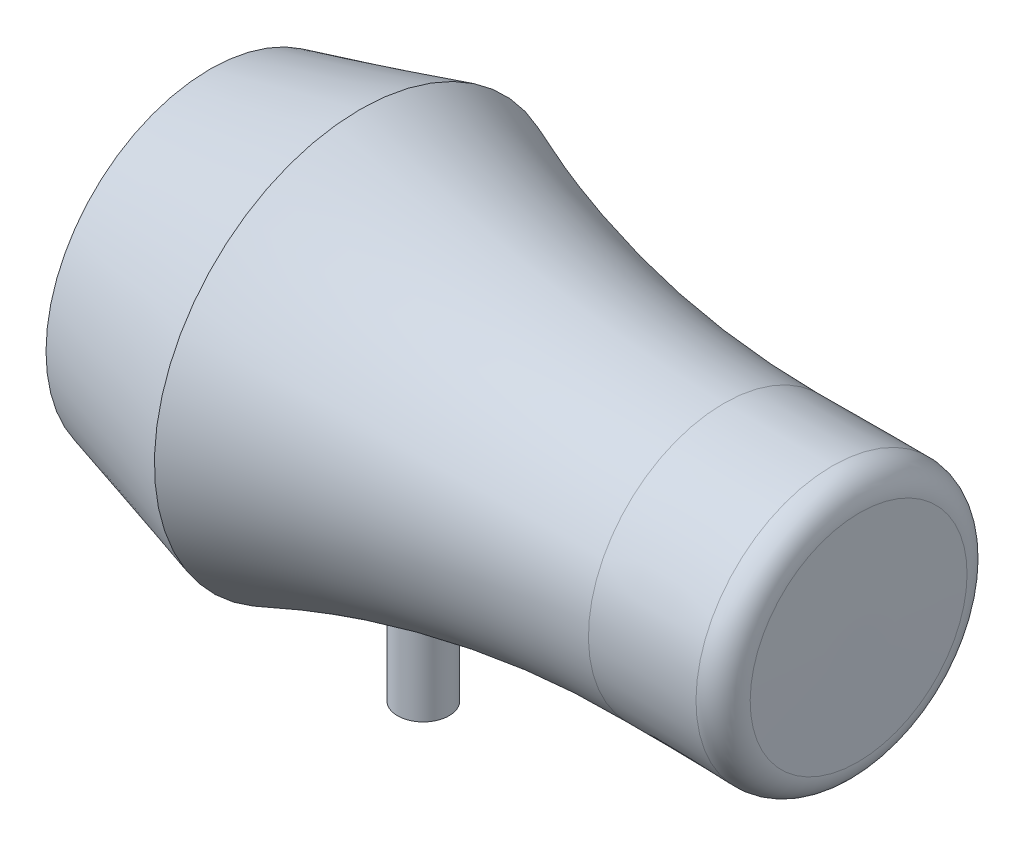
from build123d import *

# Parameters (mm, degrees)
FILLET2_R           = 5.08
SKETCH3_R           = 4.826
BOSS_EXTRUDE1_DEPTH = 12.7
SKETCH5_R           = 4.826
BOSS_EXTRUDE2_DEPTH = 12.7


with BuildPart() as part:
    # Sketch1 → Revolve2 (revolve)
    with BuildSketch(Plane.XY):
        with BuildLine():
            Line((45.524615385, -0.976923077), (45.524615385, 24.423076923))
            Line((45.524615385, 24.423076923), (20.124615385, 24.423076923))
            ThreePointArc((20.124615385, 24.423076923), (-14.744833443, 27.875832785), (-48.26, 38.1))
            Line((-48.26, 38.1), (-50.8, 38.1))
            Line((-50.8, 38.1), (-76.2, 38.1))
            Line((-76.2, 38.1), (-76.2, 0))
            Line((-76.2, 0), (45.524615385, -0.976923077))
        make_face()
    revolve(axis=Axis((45.524615385, -0.976923077, 0), (-0.9999677957684845, 0.008025423722058495, 0)))

    # Fillet2
    fillet2_edges = [part.edges().sort_by_distance(p)[0] for p in [
        (45.116936989, -26.37365118, 0),
    ]]
    fillet(fillet2_edges, radius=FILLET2_R)

    # Chamfer1: read off the stored shape, not the designer's step
    # Chamfer1 outline → Chamfer1 (revolve, cut)
    with BuildSketch(Plane(origin=(-0.004907846, -0.611517594, 0), x_dir=(0.008025423722058226, 0.9999677957684845, 0), z_dir=(0, 0, -1))):
        Polygon((30.479018415, -76.442160953), (30.479018415, -76.503314681), (38.098773019, -76.503314681), (38.323003358, -48.564214468), (38.323003358, -48.368371001), (38.243376135, -48.368371001), align=None)
    revolve(axis=Axis((-0.004907846, -0.611517594, 0), (0.9999677957684845, -0.008025423722058226, 0)), mode=Mode.SUBTRACT)

    # Sketch3 → Boss-Extrude1 (add, symmetric)
    with BuildSketch(Plane(origin=(-76.2, 0, 0), x_dir=(0, 0, -1), z_dir=(1, 0, 0))):
        with Locations(Location((0, 0, 0), (0, 0, 305.528030249))):
            Circle(SKETCH3_R)
    extrude(amount=BOSS_EXTRUDE1_DEPTH, both=True)

    # Sketch5 → Boss-Extrude2 (add, symmetric)
    with BuildSketch(Plane(origin=(0, -39.37, 0), x_dir=(1, 0, 0), z_dir=(0, 1, 0))):
        with Locations(Location((-36.216917905, 0, 0), (0, 0, 141.940248705))):
            Circle(SKETCH5_R)
    extrude(amount=BOSS_EXTRUDE2_DEPTH, both=True)


solid = part.part
